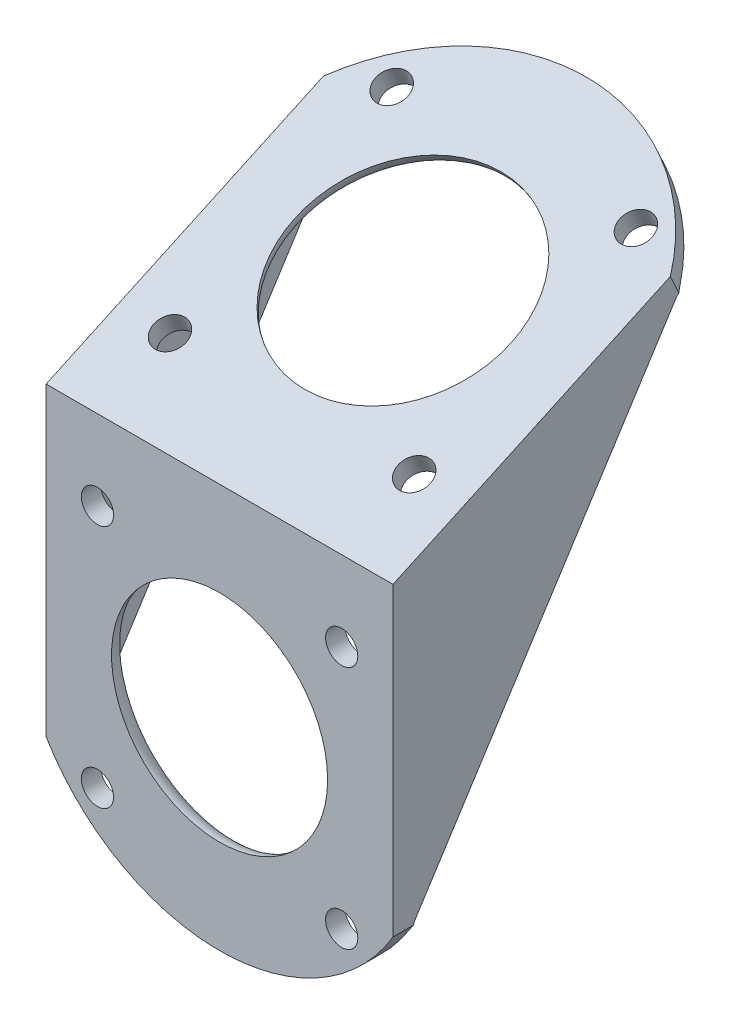
from build123d import *

# Parameters (mm, degrees)
SKETCH1_R           = 1.651
SKETCH1_R_2         = 11.07313
BOSS_EXTRUDE1_DEPTH = 2
BOSS_EXTRUDE2_DEPTH = 2
FILLET2_R           = 2
FILLET3_R           = 2


with BuildPart() as part:
    # Sketch1 → Boss-Extrude1 (new body)
    with BuildSketch(Plane.XY):
        with BuildLine():
            Line((-17.78, -10.602028155), (-17.78, 20.701))
            Line((-17.78, 20.701), (17.78, 20.701))
            Line((17.78, 20.701), (17.78, -10.602028155))
            ThreePointArc((17.78, -10.602028155), (0, -20.701), (-17.78, -10.602028155))
        make_face()
        with Locations((-12.515790027, -12.515790027)):
            Circle(SKETCH1_R, mode=Mode.SUBTRACT)
        with Locations((12.515790027, -12.515790027)):
            Circle(SKETCH1_R, mode=Mode.SUBTRACT)
        with Locations((12.515790027, 12.515790027)):
            Circle(SKETCH1_R, mode=Mode.SUBTRACT)
        with Locations((-12.515790027, 12.515790027)):
            Circle(SKETCH1_R, mode=Mode.SUBTRACT)
        Circle(SKETCH1_R_2, mode=Mode.SUBTRACT)
    boss_extrude1 = extrude(amount=BOSS_EXTRUDE1_DEPTH)

    # Mirror1: Boss-Extrude1 across plane
    add(boss_extrude1.mirror(Plane(origin=(0, 13.78083487, -8.816600885), x_dir=(0, 0.5389178124813573, 0.8423583509352233), z_dir=(0, -0.8423583509352232, 0.5389178124813573))))

    # Sketch2 → Boss-Extrude2 (add)
    with BuildSketch(Plane.ZY.offset(17.78)):
        Polygon((0, -10.602028155), (-27.25903588, 32.005352748), (0, 19.421454752), align=None)
    boss_extrude2 = extrude(amount=-BOSS_EXTRUDE2_DEPTH)

    # Mirror2: Boss-Extrude2 across plane
    add(boss_extrude2.mirror(Plane(origin=(0, 0, 0), x_dir=(0, 0, 1), z_dir=(1, 0, 0))))

    # Fillet2
    fillet2_edges = [part.edges().sort_by_distance(p)[0] for p in [
        (-11.07313, 0, 0),
        (-11.07313, 27.561669739, -17.63320177),
    ]]
    fillet(fillet2_edges, radius=FILLET2_R - 0.0001)  # a hair under: the kernel refuses the full size

    # Fillet3
    fillet3_edges = [part.edges().sort_by_distance(p)[0] for p in [
        (-16.78, -10.602028155, 0),
        (-16.78, 32.005352748, -27.25903588),
        (16.78, -10.602028155, 0),
        (16.78, 32.005352748, -27.25903588),
    ]]
    fillet(fillet3_edges, radius=FILLET3_R)


solid = part.part
